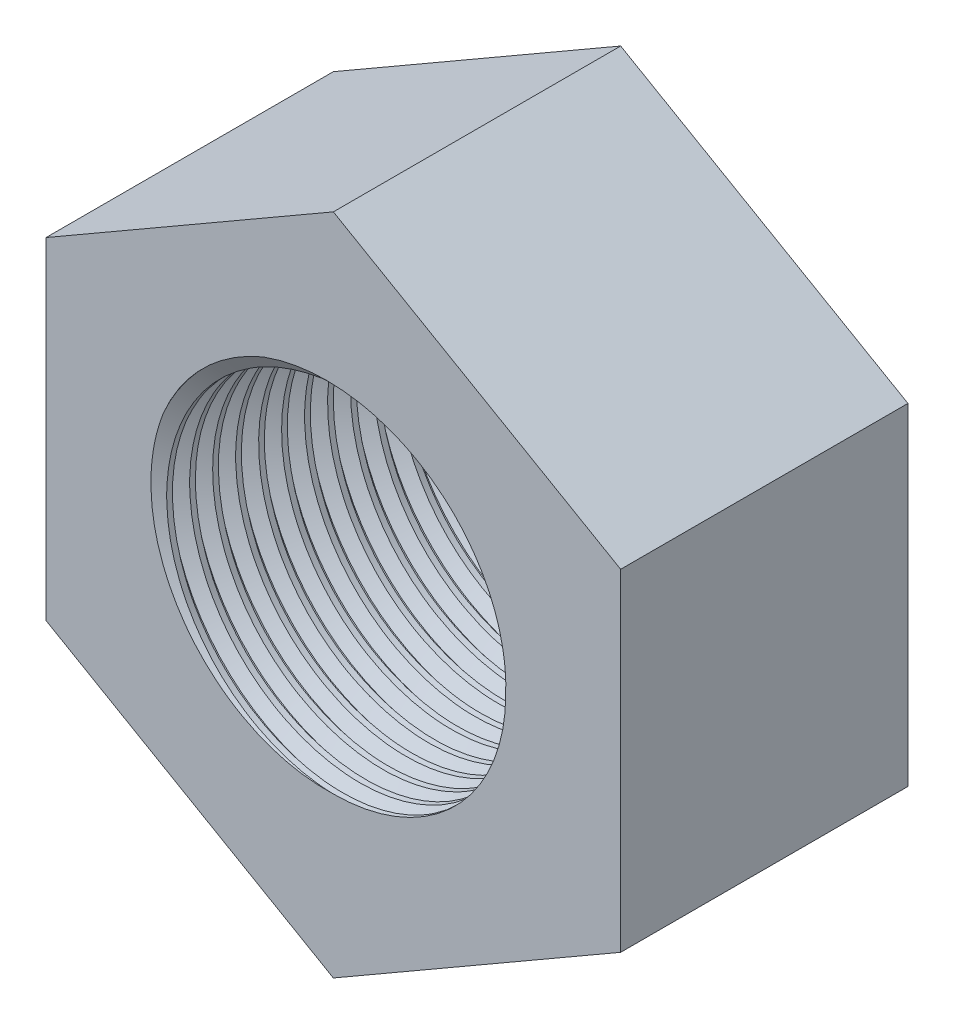
from build123d import *

# Parameters (mm, degrees)
CROQUIS1_R              = 3
SALIENTE_EXTRUIR1_DEPTH = 5
ROSCA1_PITCH            = 0.4


with BuildPart() as part:
    # Croquis1 → Saliente-Extruir1 (new body)
    with BuildSketch(Plane.XY):
        Polygon((0, 5.773502692), (-5, 2.886751346), (-5, -2.886751346), (0, -5.773502692), (5, -2.886751346), (5, 2.886751346), align=None)
        Circle(CROQUIS1_R, mode=Mode.SUBTRACT)
    extrude(amount=SALIENTE_EXTRUIR1_DEPTH)

    # Rosca1: the profile of Perfil de rosca1 profile screwed along a right-hand helix of 37.5 turns, 6 arcs to a turn; built about Z, then put on its axis
    rosca1_z = Axis((0, 0, 0), (0, 0, 1))
    rosca1_corners = [(2.9997, 0, -0.000173205), (3.21650635, 0, 0.124999999), (3.21650635, 0, 0.174999999), (2.9997, 0, 0.300173204)]
    with BuildLine(mode=Mode.PRIVATE) as rosca1_profile:
        Line(rosca1_corners[0], rosca1_corners[1])
        Line(rosca1_corners[1], rosca1_corners[2])
        Line(rosca1_corners[2], rosca1_corners[3])
        Line(rosca1_corners[3], rosca1_corners[0])
    rosca1_cap = Face(rosca1_profile.wire())
    rosca1_turn_angles = [0, 30, 60, 90, 120, 150, 180, 210, 240, 270, 300, 330, 360, 390, 420, 450, 480, 510, 540, 570, 600, 630, 660, 690, 720]
    rosca1_turn_weights = [1, 0.8660254037844387, 1, 0.8660254037844387, 1, 0.8660254037844387, 1, 0.8660254037844387, 1, 0.8660254037844387, 1, 0.8660254037844387, 1, 0.8660254037844387, 1, 0.8660254037844387, 1, 0.8660254037844387, 1, 0.8660254037844387, 1, 0.8660254037844387, 1, 0.8660254037844387, 1]
    rosca1_turn_rails = [Edge.make_bspline([Vector(p[0], p[1], 0).rotate(rosca1_z, rosca1_turn_angles[k]) / rosca1_turn_weights[k] + Vector(0, 0, p[2] + ROSCA1_PITCH * rosca1_turn_angles[k] / 360) for k in range(25)], [0, 0, 0, 1, 1, 2, 2, 3, 3, 4, 4, 5, 5, 6, 6, 7, 7, 8, 8, 9, 9, 10, 10, 11, 11, 12, 12, 12], 2, rosca1_turn_weights) for p in rosca1_corners]
    rosca1_turn_sides = [Face.make_surface_from_curves(rosca1_turn_rails[p[0]], rosca1_turn_rails[p[1]]) for p in [(0, 1), (1, 2), (2, 3), (3, 0)]]
    rosca1_last_angles = [12960, 12990, 13020, 13050, 13080, 13110, 13140, 13170, 13200, 13230, 13260, 13290, 13320, 13350, 13380, 13410, 13440, 13470, 13500]
    rosca1_last_weights = [1, 0.8660254037844387, 1, 0.8660254037844387, 1, 0.8660254037844387, 1, 0.8660254037844387, 1, 0.8660254037844387, 1, 0.8660254037844387, 1, 0.8660254037844387, 1, 0.8660254037844387, 1, 0.8660254037844387, 1]
    rosca1_last_rails = [Edge.make_bspline([Vector(p[0], p[1], 0).rotate(rosca1_z, rosca1_last_angles[k]) / rosca1_last_weights[k] + Vector(0, 0, p[2] + ROSCA1_PITCH * rosca1_last_angles[k] / 360) for k in range(19)], [0, 0, 0, 1, 1, 2, 2, 3, 3, 4, 4, 5, 5, 6, 6, 7, 7, 8, 8, 9, 9, 9], 2, rosca1_last_weights) for p in rosca1_corners]
    rosca1_last_sides = [Face.make_surface_from_curves(rosca1_last_rails[p[0]], rosca1_last_rails[p[1]]) for p in [(0, 1), (1, 2), (2, 3), (3, 0)]]
    rosca1 = Plane(origin=(0, 0, 6), x_dir=(-1, 0, 0), z_dir=(0, 0, -1)) * Solid(Shell([*[p.moved(Location((0, 0, 2 * ROSCA1_PITCH * i))) for i in range(18) for p in rosca1_turn_sides], *rosca1_last_sides, rosca1_cap, rosca1_cap.rotate(rosca1_z, 13500).moved(Location((0, 0, ROSCA1_PITCH * 13500 / 360)))]))
    add(rosca1, mode=Mode.SUBTRACT)


solid = part.part
